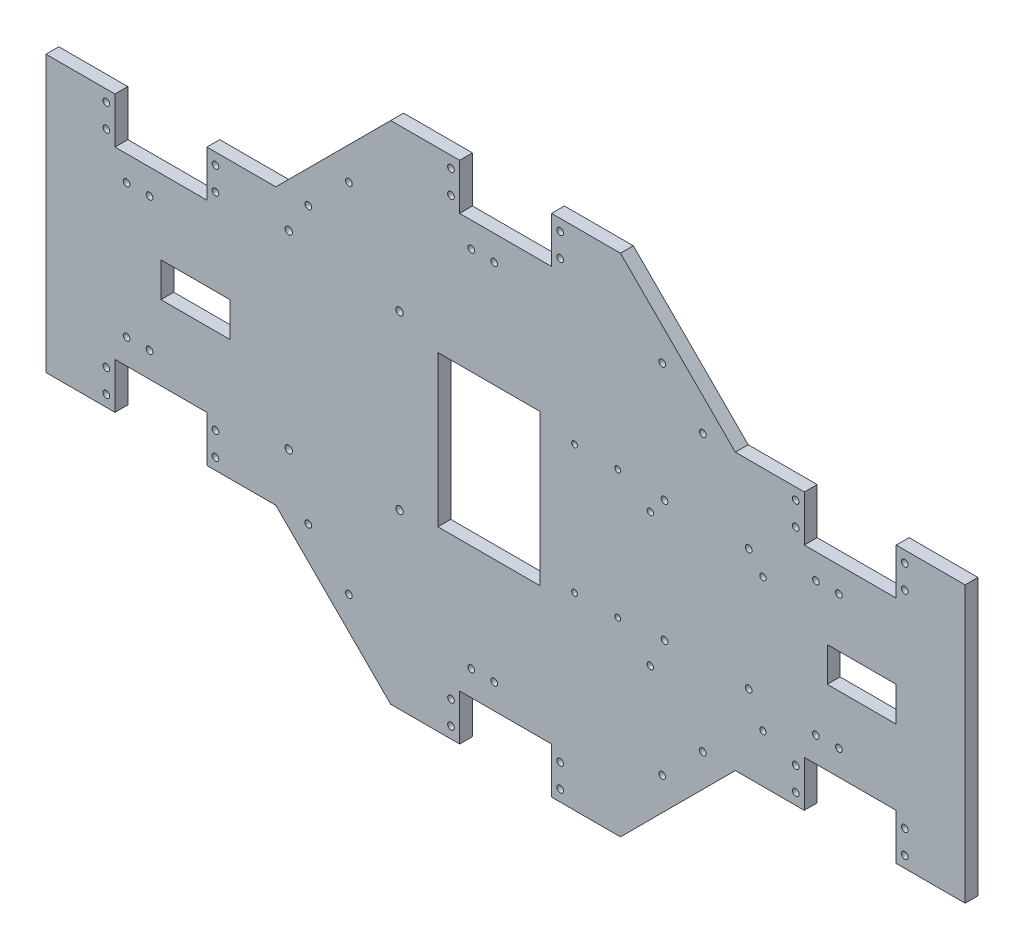
from build123d import *

# Parameters (mm, degrees)
BOSS_EXTRU_1_DEPTH       = 5.6
ENL_V_MAT_EXTRU_1_REACH  = 416.887
ESQUISSE2_W              = 40
ESQUISSE2_H              = 20
ENL_V_MAT_EXTRU_2_REACH  = 416.887
ESQUISSE3_R              = 1.45
SKETCH2_W                = 40
SKETCH2_H                = 20
CUT_EXTRUDE2_DEPTH       = 415.887165384
SKETCH5_R                = 1.45
CUT_EXTRUDE4_DEPTH       = 415.887165384
ESQUISSE4_R              = 1.375
ENL_V_MAT_EXTRU_4_DEPTH  = 415.887165384
ESQUISSE6_R              = 1.45
ENL_V_MAT_EXTRU_6_DEPTH  = 415.887165384
ESQUISSE8_R              = 1.25
ENL_V_MAT_EXTRU_7_DEPTH  = 415.887165384
ESQUISSE9_R              = 1.6
ENL_V_MAT_EXTRU_8_DEPTH  = 415.887165384
ESQUISSE10_W             = 44.45
ESQUISSE10_H             = 65.69
ENL_V_MAT_EXTRU_9_DEPTH  = 415.887165384
ESQUISSE11_W             = 30
ESQUISSE11_H             = 15
ENL_V_MAT_EXTRU_10_DEPTH = 415.887165384
ESQUISSE12_R             = 1.45
ENL_V_MAT_EXTRU_11_DEPTH = 415.887165384


with BuildPart() as part:
    # Esquisse1 → Boss.-Extru.1 (new body)
    with BuildSketch(Plane.XY):
        Polygon((100, -60), (150, -110), (250, -110), (300, -60), (400, -60), (400, 0), (25.838605695, 0), (0, 0), (0, -60), align=None)
    boss_extru_1 = extrude(amount=BOSS_EXTRU_1_DEPTH)

    # Esquisse2 → Enlèv. mat.-Extru.1 (cut, up to next)
    with BuildSketch(Plane.XY.offset(5.6), mode=Mode.PRIVATE) as enl_v_mat_extru_1_sk1:
        with Locations((50, -50)):
            Rectangle(ESQUISSE2_W, ESQUISSE2_H)
    enl_v_mat_extru_1_tool1 = extrude(enl_v_mat_extru_1_sk1.sketch, amount=-ENL_V_MAT_EXTRU_1_REACH, mode=Mode.PRIVATE) & part.part
    enl_v_mat_extru_1 = enl_v_mat_extru_1_tool1.solids().sort_by_distance((50, -50, 5.6))[0]
    add(enl_v_mat_extru_1, mode=Mode.SUBTRACT)

    # Esquisse3 → Enlèv. mat.-Extru.2 (cut, up to next)
    with BuildSketch(Plane.XY.offset(5.6), mode=Mode.PRIVATE) as enl_v_mat_extru_2_sk1:
        with Locations((26.25, -55.08)):
            Circle(ESQUISSE3_R)
    enl_v_mat_extru_2_tool1 = extrude(enl_v_mat_extru_2_sk1.sketch, amount=-ENL_V_MAT_EXTRU_2_REACH, mode=Mode.PRIVATE) & part.part
    # Esquisse3 → Enlèv. mat.-Extru.2 (cut, up to next)
    with BuildSketch(Plane.XY.offset(5.6), mode=Mode.PRIVATE) as enl_v_mat_extru_2_sk2:
        with Locations((73.75, -55.08)):
            Circle(ESQUISSE3_R)
    enl_v_mat_extru_2_tool2 = extrude(enl_v_mat_extru_2_sk2.sketch, amount=-ENL_V_MAT_EXTRU_2_REACH, mode=Mode.PRIVATE) & part.part
    # Esquisse3 → Enlèv. mat.-Extru.2 (cut, up to next)
    with BuildSketch(Plane.XY.offset(5.6), mode=Mode.PRIVATE) as enl_v_mat_extru_2_sk3:
        with Locations((73.75, -44.92)):
            Circle(ESQUISSE3_R)
    enl_v_mat_extru_2_tool3 = extrude(enl_v_mat_extru_2_sk3.sketch, amount=-ENL_V_MAT_EXTRU_2_REACH, mode=Mode.PRIVATE) & part.part
    # Esquisse3 → Enlèv. mat.-Extru.2 (cut, up to next)
    with BuildSketch(Plane.XY.offset(5.6), mode=Mode.PRIVATE) as enl_v_mat_extru_2_sk4:
        with Locations((26.25, -44.92)):
            Circle(ESQUISSE3_R)
    enl_v_mat_extru_2_tool4 = extrude(enl_v_mat_extru_2_sk4.sketch, amount=-ENL_V_MAT_EXTRU_2_REACH, mode=Mode.PRIVATE) & part.part
    # Esquisse3 → Enlèv. mat.-Extru.2 (cut, up to next)
    with BuildSketch(Plane.XY.offset(5.6), mode=Mode.PRIVATE) as enl_v_mat_extru_2_sk5:
        with Locations((35.06, -29.09)):
            Circle(ESQUISSE3_R)
    enl_v_mat_extru_2_tool5 = extrude(enl_v_mat_extru_2_sk5.sketch, amount=-ENL_V_MAT_EXTRU_2_REACH, mode=Mode.PRIVATE) & part.part
    # Esquisse3 → Enlèv. mat.-Extru.2 (cut, up to next)
    with BuildSketch(Plane.XY.offset(5.6), mode=Mode.PRIVATE) as enl_v_mat_extru_2_sk6:
        with Locations((45.06, -29.09)):
            Circle(ESQUISSE3_R)
    enl_v_mat_extru_2_tool6 = extrude(enl_v_mat_extru_2_sk6.sketch, amount=-ENL_V_MAT_EXTRU_2_REACH, mode=Mode.PRIVATE) & part.part
    enl_v_mat_extru_2_1 = enl_v_mat_extru_2_tool1.solids().sort_by_distance((26.25, -55.08, 5.6))[0]
    add(enl_v_mat_extru_2_1, mode=Mode.SUBTRACT)
    enl_v_mat_extru_2_2 = enl_v_mat_extru_2_tool2.solids().sort_by_distance((73.75, -55.08, 5.6))[0]
    add(enl_v_mat_extru_2_2, mode=Mode.SUBTRACT)
    enl_v_mat_extru_2_3 = enl_v_mat_extru_2_tool3.solids().sort_by_distance((73.75, -44.92, 5.6))[0]
    add(enl_v_mat_extru_2_3, mode=Mode.SUBTRACT)
    enl_v_mat_extru_2_4 = enl_v_mat_extru_2_tool4.solids().sort_by_distance((26.25, -44.92, 5.6))[0]
    add(enl_v_mat_extru_2_4, mode=Mode.SUBTRACT)
    enl_v_mat_extru_2_5 = enl_v_mat_extru_2_tool5.solids().sort_by_distance((35.06, -29.09, 5.6))[0]
    add(enl_v_mat_extru_2_5, mode=Mode.SUBTRACT)
    enl_v_mat_extru_2_6 = enl_v_mat_extru_2_tool6.solids().sort_by_distance((45.06, -29.09, 5.6))[0]
    add(enl_v_mat_extru_2_6, mode=Mode.SUBTRACT)
    enl_v_mat_extru_2 = enl_v_mat_extru_2_1 + enl_v_mat_extru_2_2 + enl_v_mat_extru_2_3 + enl_v_mat_extru_2_4 + enl_v_mat_extru_2_5 + enl_v_mat_extru_2_6  # Enlèv. mat.-Extru.2 as one shape, for the pattern or mirror that repeats it

    # Sketch2 → Cut-Extrude2 (cut, symmetric)
    with BuildSketch(Plane.XY):
        with Locations((350, -50)):
            Rectangle(SKETCH2_W, SKETCH2_H)
        with Locations((200, -100)):
            Rectangle(SKETCH2_W, SKETCH2_H)
    cut_extrude2 = extrude(amount=CUT_EXTRUDE2_DEPTH, both=True, mode=Mode.SUBTRACT)

    # Sketch5 → Cut-Extrude4 (cut, through all)
    with BuildSketch(Plane.XY):
        with Locations((176.25, -105.08)):
            Circle(SKETCH5_R)
        with Locations((223.75, -105.08)):
            Circle(SKETCH5_R)
        with Locations((223.75, -94.92)):
            Circle(SKETCH5_R)
        with Locations((176.25, -94.92)):
            Circle(SKETCH5_R)
        with Locations((326.25, -55.08)):
            Circle(SKETCH5_R)
        with Locations((373.75, -55.08)):
            Circle(SKETCH5_R)
        with Locations((373.75, -44.92)):
            Circle(SKETCH5_R)
        with Locations((326.25, -44.92)):
            Circle(SKETCH5_R)
        with Locations((185.06, -79.09)):
            Circle(SKETCH5_R)
        with Locations((195.06, -79.09)):
            Circle(SKETCH5_R)
        with Locations((335.06, -29.09)):
            Circle(SKETCH5_R)
        with Locations((345.06, -29.09)):
            Circle(SKETCH5_R)
    cut_extrude4 = extrude(amount=CUT_EXTRUDE4_DEPTH, mode=Mode.SUBTRACT)

    # Mirror1: Boss.-Extru.1, Enlèv. mat.-Extru.1, Enlèv. mat.-Extru.2, Cut-Extrude2, Cut-Extrude4 across plane
    add(boss_extru_1.mirror(Plane.ZX))
    add(enl_v_mat_extru_1.mirror(Plane.ZX), mode=Mode.SUBTRACT)
    add(enl_v_mat_extru_2.mirror(Plane.ZX), mode=Mode.SUBTRACT)
    add(cut_extrude2.mirror(Plane.ZX), mode=Mode.SUBTRACT)
    add(cut_extrude4.mirror(Plane.ZX), mode=Mode.SUBTRACT)

    # Esquisse4 → Enlèv. mat.-Extru.4 (cut, through all)
    with BuildSketch(Plane.XY.offset(5.6)):
        with Locations((263, -39)):
            Circle(ESQUISSE4_R)
        with Locations((312, -39)):
            Circle(ESQUISSE4_R)
        with Locations((312, 19)):
            Circle(ESQUISSE4_R)
        with Locations((263, 19)):
            Circle(ESQUISSE4_R)
    extrude(amount=-ENL_V_MAT_EXTRU_4_DEPTH, mode=Mode.SUBTRACT)

    # Esquisse6 → Enlèv. mat.-Extru.6 (cut, through all)
    with BuildSketch(Plane(origin=(0, 0, 0), x_dir=(-1, 0, 0), z_dir=(0, 0, -1))):
        with Locations((-269.19, -26.31)):
            Circle(ESQUISSE6_R)
        with Locations((-305.82, -26.31)):
            Circle(ESQUISSE6_R)
        with Locations((-305.82, 26.52)):
            Circle(ESQUISSE6_R)
        with Locations((-269.19, 26.52)):
            Circle(ESQUISSE6_R)
    extrude(amount=-ENL_V_MAT_EXTRU_6_DEPTH, mode=Mode.SUBTRACT)

    # Esquisse8 → Enlèv. mat.-Extru.7 (cut, through all)
    with BuildSketch(Plane(origin=(0, 0, 0), x_dir=(-1, 0, 0), z_dir=(0, 0, -1))):
        with Locations((-230, 27.95)):
            Circle(ESQUISSE8_R)
        with Locations((-248.8, 27.95)):
            Circle(ESQUISSE8_R)
        with Locations((-248.8, -27.95)):
            Circle(ESQUISSE8_R)
        with Locations((-230, -27.95)):
            Circle(ESQUISSE8_R)
    extrude(amount=-ENL_V_MAT_EXTRU_7_DEPTH, mode=Mode.SUBTRACT)

    # Esquisse9 → Enlèv. mat.-Extru.8 (cut, through all)
    with BuildSketch(Plane(origin=(0, 0, 0), x_dir=(-1, 0, 0), z_dir=(0, 0, -1))):
        with Locations((-153.85903462, -34.88)):
            Circle(ESQUISSE9_R)
        with Locations((-105.63903462, -36.11)):
            Circle(ESQUISSE9_R)
        with Locations((-105.63903462, 46.36)):
            Circle(ESQUISSE9_R)
        with Locations((-153.85903462, 40)):
            Circle(ESQUISSE9_R)
    extrude(amount=-ENL_V_MAT_EXTRU_8_DEPTH, mode=Mode.SUBTRACT)

    # Esquisse10 → Enlèv. mat.-Extru.9 (cut, through all)
    with BuildSketch(Plane(origin=(0, 0, 0), x_dir=(-1, 0, 0), z_dir=(0, 0, -1))):
        with Locations((-192.775, 0)):
            Rectangle(ESQUISSE10_W, ESQUISSE10_H)
    extrude(amount=-ENL_V_MAT_EXTRU_9_DEPTH, mode=Mode.SUBTRACT)

    # Esquisse11 → Enlèv. mat.-Extru.10 (cut, through all)
    with BuildSketch(Plane(origin=(0, 0, 0), x_dir=(-1, 0, 0), z_dir=(0, 0, -1))):
        with Locations((-355, 0)):
            Rectangle(ESQUISSE11_W, ESQUISSE11_H)
        with Locations((-65, 0)):
            Rectangle(ESQUISSE11_W, ESQUISSE11_H)
    extrude(amount=-ENL_V_MAT_EXTRU_10_DEPTH, mode=Mode.SUBTRACT)

    # Esquisse12 → Enlèv. mat.-Extru.11 (cut, through all)
    with BuildSketch(Plane.XY.offset(5.6)):
        with Locations((131.819805153, 77.67766953)):
            Circle(ESQUISSE12_R)
        with Locations((114.142135624, 60)):
            Circle(ESQUISSE12_R)
        with Locations((285.857864376, 60)):
            Circle(ESQUISSE12_R)
        with Locations((268.180194847, 77.67766953)):
            Circle(ESQUISSE12_R)
        with Locations((285.857864376, -60)):
            Circle(ESQUISSE12_R)
        with Locations((268.180194847, -77.67766953)):
            Circle(ESQUISSE12_R)
        with Locations((131.819805153, -77.67766953)):
            Circle(ESQUISSE12_R)
        with Locations((114.142135624, -60)):
            Circle(ESQUISSE12_R)
    extrude(amount=-ENL_V_MAT_EXTRU_11_DEPTH, mode=Mode.SUBTRACT)


solid = part.part
